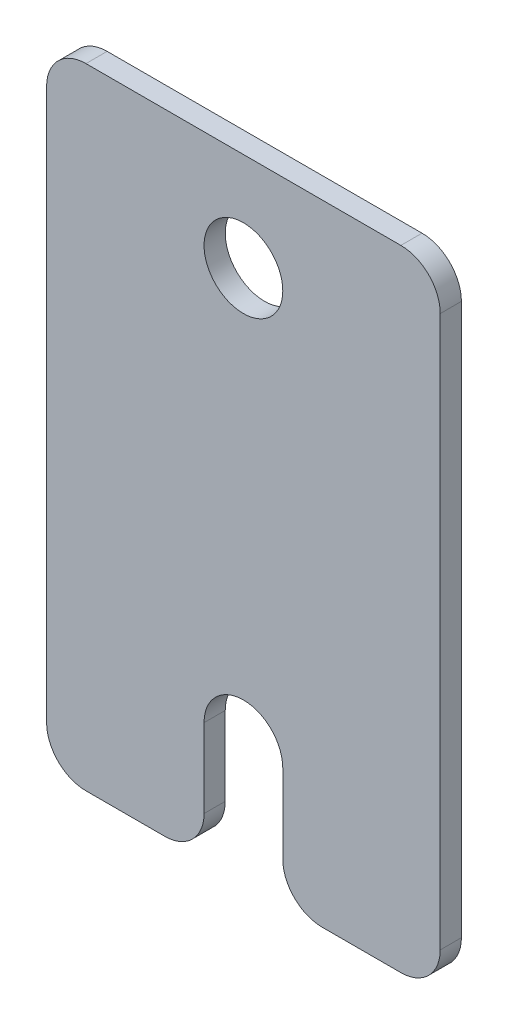
from build123d import *

# Parameters (mm, degrees)
CROQUIS1_W            = 63.5
CROQUIS1_H            = 101.6
BRIDA_BASE1_DEPTH     = 3.4163
CROQUIS2_R            = 6.35
CORTAR_EXTRUIR1_DEPTH = 61.0031133
ROMPER_START          = -3.4163
ROMPER_ESQUINA1_DEPTH = 3.4163


# Read off the part's stored shape, not the designer's step: Romper esquina1
# Sheet-metal steps are written as plain solids
with BuildPart() as part:
    # Croquis1 → Brida base1 (new body)
    with BuildSketch(Plane.XY):
        Rectangle(CROQUIS1_W, CROQUIS1_H)
    extrude(amount=-BRIDA_BASE1_DEPTH)

    # Croquis2 → Cortar-Extruir1 (cut, through all)
    with BuildSketch(Plane.XY):
        with Locations((0, 34.925)):
            Circle(CROQUIS2_R)
        with BuildLine():
            Line((6.35, -31.75), (6.35, -50.8))
            ThreePointArc((6.35, -50.8), (0, -57.15), (-6.35, -50.8))
            Line((-6.35, -50.8), (-6.35, -31.75))
            ThreePointArc((-6.35, -31.75), (0, -25.4), (6.35, -31.75))
        make_face()
    extrude(amount=-CORTAR_EXTRUIR1_DEPTH, mode=Mode.SUBTRACT)

    # Romper esquina1 outline → Romper esquina1 (cut)
    with BuildSketch(Plane.XY.offset(ROMPER_START)):
        with BuildLine():
            Line((6.35, -50.8), (12.7, -50.8))
            ThreePointArc((12.7, -50.8), (8.209871939, -48.940128061), (6.35, -44.45))
            Line((6.35, -44.45), (6.35, -50.8))
        make_face()
        with BuildLine():
            ThreePointArc((-6.35, -44.45), (-8.209871939, -48.940128061), (-12.7, -50.8))
            Line((-12.7, -50.8), (-6.35, -50.8))
            Line((-6.35, -50.8), (-6.35, -44.45))
        make_face()
        with BuildLine():
            ThreePointArc((-25.4, -50.8), (-29.890128061, -48.940128061), (-31.75, -44.45))
            Line((-31.75, -44.45), (-31.75, -50.8))
            Line((-31.75, -50.8), (-25.4, -50.8))
        make_face()
        with BuildLine():
            ThreePointArc((-31.75, 44.45), (-29.890128061, 48.940128061), (-25.4, 50.8))
            Line((-25.4, 50.8), (-31.75, 50.8))
            Line((-31.75, 50.8), (-31.75, 44.45))
        make_face()
        with BuildLine():
            ThreePointArc((25.4, 50.8), (29.890128061, 48.940128061), (31.75, 44.45))
            Line((31.75, 44.45), (31.75, 50.8))
            Line((31.75, 50.8), (25.4, 50.8))
        make_face()
        with BuildLine():
            ThreePointArc((31.75, -44.45), (29.890128061, -48.940128061), (25.4, -50.8))
            Line((25.4, -50.8), (31.75, -50.8))
            Line((31.75, -50.8), (31.75, -44.45))
        make_face()
    extrude(amount=ROMPER_ESQUINA1_DEPTH, mode=Mode.SUBTRACT)


solid = part.part
